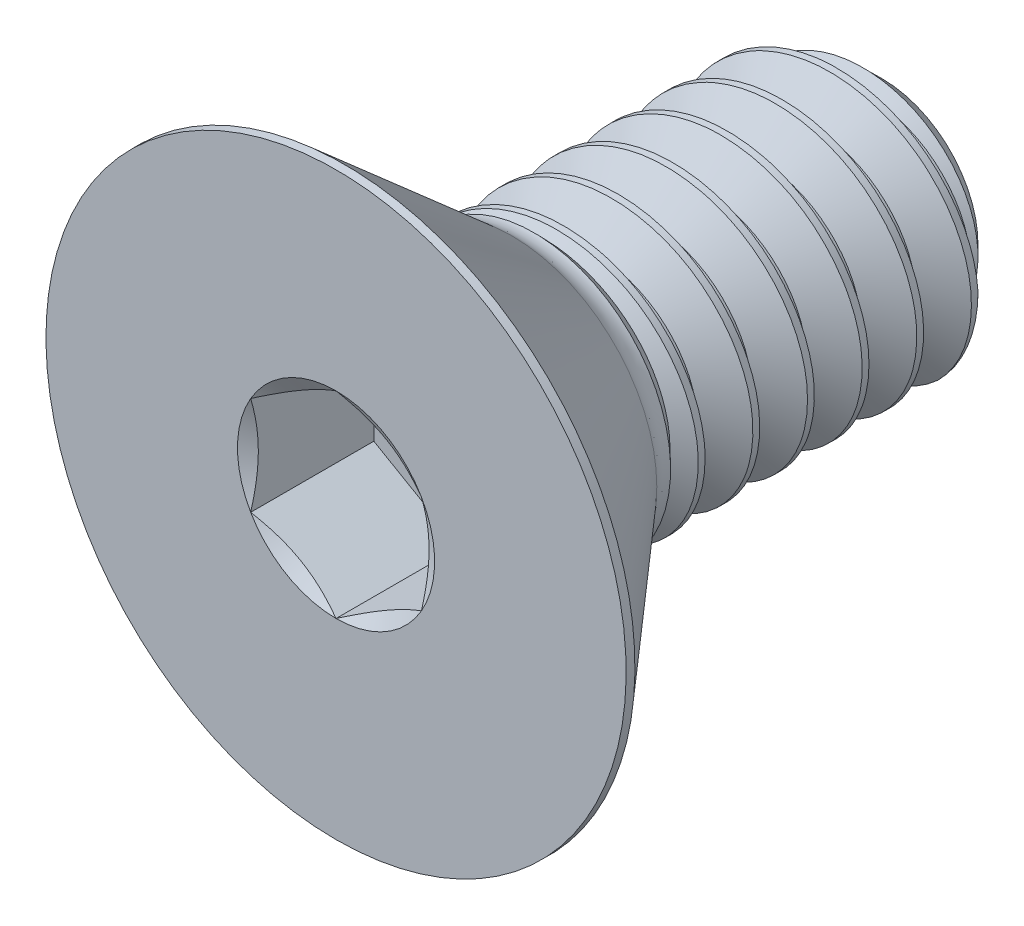
from build123d import *

# Parameters (mm, degrees)
SKETCH1_W          = 12.7
SKETCH1_H          = 3.175
CHAMFER1_SIZE      = 0.9525
CUT_SWEEP1_PITCH   = 1.27
CUT_EXTRUDE2_DEPTH = 2.86258


with BuildPart() as part:
    # Sketch1 → Revolve1 (revolve)
    with BuildSketch(Plane(origin=(0, 0, 0), x_dir=(0, 0, -1), z_dir=(1, 0, 0))):
        with Locations((6.35, 1.5875)):
            Rectangle(SKETCH1_W, SKETCH1_H)
    revolve(axis=Axis((0, 0, -12.7), (0, 0, 1)))

    # Chamfer1
    chamfer1_edges = [part.edges().sort_by_distance(p)[0] for p in [
        (0, -3.175, -12.7),
    ]]
    chamfer(chamfer1_edges, length=CHAMFER1_SIZE)

    # Cut-Sweep1: the profile of Sketch2 profile screwed along a right-hand helix of 10 turns, 8 arcs to a turn; built about Z, then put on its axis
    cut_sweep1_z = Axis((0, 0, 0), (0, 0, 1))
    cut_sweep1_corners = [(3.1756, 0, 0.00034641), (3.1756, 0, -1.11159641), (2.350110803, 0, -0.635), (2.350110803, 0, -0.47625)]
    with BuildLine(mode=Mode.PRIVATE) as cut_sweep1_profile:
        Line(cut_sweep1_corners[0], cut_sweep1_corners[1])
        Line(cut_sweep1_corners[1], cut_sweep1_corners[2])
        Line(cut_sweep1_corners[2], cut_sweep1_corners[3])
        Line(cut_sweep1_corners[3], cut_sweep1_corners[0])
    cut_sweep1_cap = Face(cut_sweep1_profile.wire())
    cut_sweep1_turn_angles = [0, 22.5, 45, 67.5, 90, 112.5, 135, 157.5, 180, 202.5, 225, 247.5, 270, 292.5, 315, 337.5, 360]
    cut_sweep1_turn_weights = [1, 0.9238795325112867, 1, 0.9238795325112867, 1, 0.9238795325112867, 1, 0.9238795325112867, 1, 0.9238795325112867, 1, 0.9238795325112867, 1, 0.9238795325112867, 1, 0.9238795325112867, 1]
    cut_sweep1_turn_rails = [Edge.make_bspline([Vector(p[0], p[1], 0).rotate(cut_sweep1_z, cut_sweep1_turn_angles[k]) / cut_sweep1_turn_weights[k] + Vector(0, 0, p[2] + CUT_SWEEP1_PITCH * cut_sweep1_turn_angles[k] / 360) for k in range(17)], [0, 0, 0, 1, 1, 2, 2, 3, 3, 4, 4, 5, 5, 6, 6, 7, 7, 8, 8, 8], 2, cut_sweep1_turn_weights) for p in cut_sweep1_corners]
    cut_sweep1_turn_sides = [Face.make_surface_from_curves(cut_sweep1_turn_rails[p[0]], cut_sweep1_turn_rails[p[1]]) for p in [(0, 1), (1, 2), (2, 3), (3, 0)]]
    cut_sweep1 = Plane(origin=(0, 0, -12.7), x_dir=(0, 1, 0), z_dir=(0, 0, 1)) * Solid(Shell([*[p.moved(Location((0, 0, CUT_SWEEP1_PITCH * i))) for i in range(10) for p in cut_sweep1_turn_sides], cut_sweep1_cap, cut_sweep1_cap.rotate(cut_sweep1_z, 3600).moved(Location((0, 0, CUT_SWEEP1_PITCH * 3600 / 360)))]))
    add(cut_sweep1, mode=Mode.SUBTRACT)

    # Sketch7 → Revolve2 (revolve)
    with BuildSketch(Plane(origin=(0, 0, 0), x_dir=(0, 0, -1), z_dir=(1, 0, 0)), mode=Mode.PRIVATE) as revolve2_sk:
        with BuildLine():
            Line((0, 6.7437), (0.20447, 6.7437))
            Line((0.20447, 6.7437), (4.0894, 3.366581874))
            ThreePointArc((4.0894, 3.366581874), (4.328282675, 3.224461616), (4.601808997, 3.175))
            Line((4.601808997, 3.175), (4.601808997, 0))
            Line((4.601808997, 0), (0, 0))
            Line((0, 0), (0, 6.7437))
        make_face()
    revolve(revolve2_sk.sketch.rotate(Axis((0, 0, 0), (0, 0, -1)), 189.052465709), axis=Axis((0, 0, 0), (0, 0, -1)))

    # Boss-Extrude1 cone 1 section (through the dimple's axis) → Boss-Extrude1 (revolve)
    with BuildSketch(Plane(origin=(0, 0, -4.601808997), x_dir=(0, -1, 0), z_dir=(1, 0, 0))):
        Polygon((0, 0), (3.175, 0), (0, 3.06606186), align=None)
    revolve(axis=Axis((0, 0, -4.601808997), (0, 0, -1)))

    # Sketch5 → Cut-Extrude2 (cut)
    with BuildSketch(Plane.XY):
        Polygon((0, 2.291358881), (-1.984375, 1.14567944), (-1.984375, -1.14567944), (0, -2.291358881), (1.984375, -1.14567944), (1.984375, 1.14567944), align=None)
    extrude(amount=-CUT_EXTRUDE2_DEPTH, mode=Mode.SUBTRACT)

    # Cut-Extrude3 cone 1 section (through the dimple's axis) → Cut-Extrude3 (revolve, cut)
    with BuildSketch(Plane(origin=(0, 0, 0), x_dir=(0, -1, 0), z_dir=(1, 0, 0))):
        Polygon((0, 0), (2.291358881, 0), (0, 1.322916667), align=None)
    revolve(axis=Axis((0, 0, 0), (0, 0, -1)), mode=Mode.SUBTRACT)


solid = part.part
